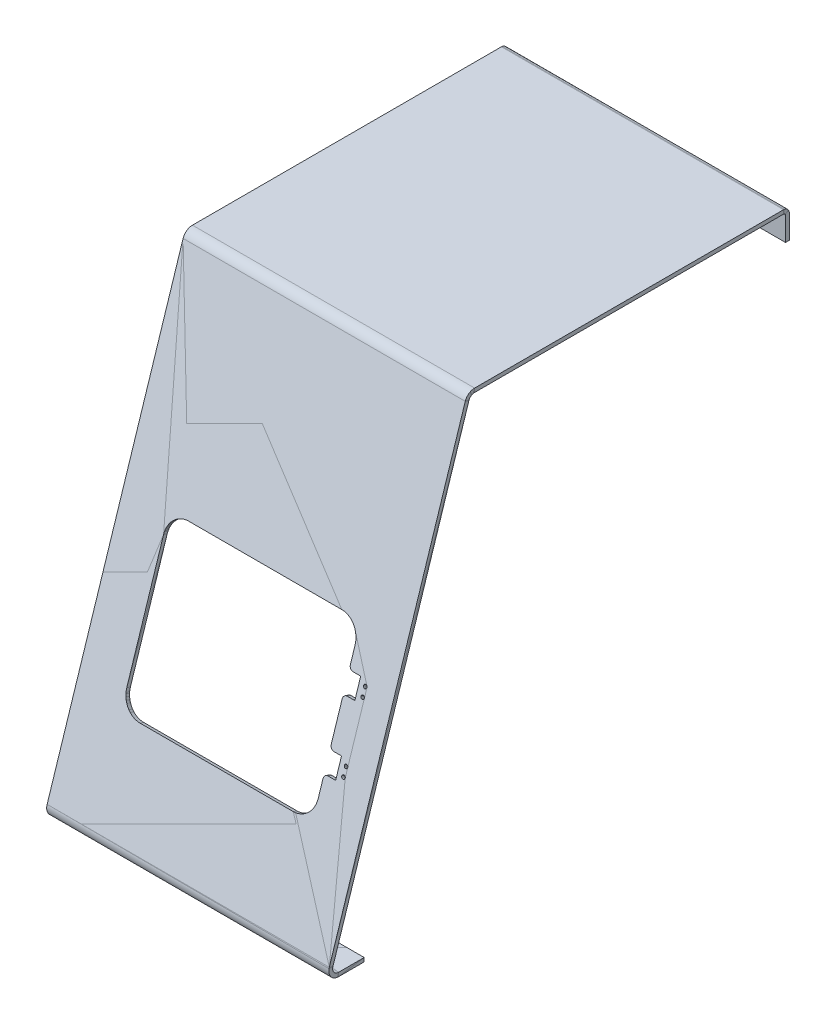
from build123d import *

# Parameters (mm, degrees)
EXTRUDE_THIN1_DEPTH    = 110.5
CUT_EXTRUDE1_REACH     = 444.866
SKETCH2_R              = 1.35
CONVERT_SOLID1_START   = -110.5
CONVERT_SOLID1_DEPTH   = 221
CONVERT_SOLID1_2_DEPTH = 35.5
CONVERT_SOLID1_START_2 = 78
CONVERT_SOLID1_3_DEPTH = 32.5
CONVERT_SOLID1_START_3 = 90.2000001
CONVERT_SOLID1_4_DEPTH = 20.2999999
CONVERT_SOLID1_START_4 = 84
CONVERT_SOLID1_5_DEPTH = 3.4999999
CONVERT_SOLID1_START_5 = 219.608669628
CONVERT_SOLID1_6_DEPTH = 3.000000001


with BuildPart() as part:
    # Sketch1 → Extrude-Thin1 (new, symmetric)
    with BuildSketch(Plane(origin=(0, 0, 0), x_dir=(0, 0, -1), z_dir=(1, 0, 0))):
        with BuildLine():
            Line((122.5, 310), (122.5, 328.5))
            ThreePointArc((122.5, 328.5), (122.060660172, 329.560660172), (121, 330))
            Line((121, 330), (-121.0014, 330))
            ThreePointArc((-121.0014, 330), (-123.764798126, 329.10018419), (-125.468557887, 326.745775479))
            Line((-125.468557887, 326.745775479), (-231.967157887, -3.867817213))
            ThreePointArc((-231.967157887, -3.867817213), (-231.293387843, -8.070194473), (-227.5, -10))
            Line((-227.5, -10), (-207.5, -10))
            Line((-207.5, -10), (-207.5, -13))
            Line((-207.5, -13), (-227.5, -13))
            ThreePointArc((-227.5, -13), (-233.718205595, -9.836619923), (-234.822664414, -2.947989795))
            Line((-234.822664414, -2.947989795), (-128.324064414, 327.665602897))
            ThreePointArc((-128.324064414, 327.665602897), (-125.531223577, 331.525001941), (-121.0014, 333))
            Line((-121.0014, 333), (121, 333))
            ThreePointArc((121, 333), (124.181980515, 331.681980515), (125.5, 328.5))
            Line((125.5, 328.5), (125.5, 310))
            Line((125.5, 310), (122.5, 310))
        make_face()
    extrude(amount=EXTRUDE_THIN1_DEPTH, both=True)

    # Sketch2 → Cut-Extrude1 (cut, up to next)
    with BuildSketch(Plane(origin=(0, 68.253852605, 211.886836303), x_dir=(1, 0, 0), z_dir=(0, 0.30660913934042044, 0.9518355087266532)), mode=Mode.PRIVATE) as cut_extrude1_sk1:
        with Locations(Location((88.85, 87.672559187, 0), (0, 0, 270))):
            Circle(SKETCH2_R)
    cut_extrude1_tool1 = extrude(cut_extrude1_sk1.sketch, amount=-CUT_EXTRUDE1_REACH, mode=Mode.PRIVATE) & part.part
    # Sketch2 → Cut-Extrude1 (cut, up to next)
    with BuildSketch(Plane(origin=(0, 68.253852605, 211.886836303), x_dir=(1, 0, 0), z_dir=(0, 0.30660913934042044, 0.9518355087266532)), mode=Mode.PRIVATE) as cut_extrude1_sk2:
        with Locations(Location((88.85, 81.072559187, 0), (0, 0, 270))):
            Circle(SKETCH2_R)
    cut_extrude1_tool2 = extrude(cut_extrude1_sk2.sketch, amount=-CUT_EXTRUDE1_REACH, mode=Mode.PRIVATE) & part.part
    # Sketch2 → Cut-Extrude1 (cut, up to next)
    with BuildSketch(Plane(origin=(0, 68.253852605, 211.886836303), x_dir=(1, 0, 0), z_dir=(0, 0.30660913934042044, 0.9518355087266532)), mode=Mode.PRIVATE) as cut_extrude1_sk3:
        with Locations(Location((88.85, 38.672559187, 0), (0, 0, 90))):
            Circle(SKETCH2_R)
    cut_extrude1_tool3 = extrude(cut_extrude1_sk3.sketch, amount=-CUT_EXTRUDE1_REACH, mode=Mode.PRIVATE) & part.part
    # Sketch2 → Cut-Extrude1 (cut, up to next)
    with BuildSketch(Plane(origin=(0, 68.253852605, 211.886836303), x_dir=(1, 0, 0), z_dir=(0, 0.30660913934042044, 0.9518355087266532)), mode=Mode.PRIVATE) as cut_extrude1_sk4:
        with Locations(Location((88.85, 32.072559187, 0), (0, 0, 90))):
            Circle(SKETCH2_R)
    cut_extrude1_tool4 = extrude(cut_extrude1_sk4.sketch, amount=-CUT_EXTRUDE1_REACH, mode=Mode.PRIVATE) & part.part
    # Sketch2 → Cut-Extrude1 (cut, up to next)
    with BuildSketch(Plane(origin=(0, 68.253852605, 211.886836303), x_dir=(1, 0, 0), z_dir=(0, 0.30660913934042044, 0.9518355087266532)), mode=Mode.PRIVATE) as cut_extrude1_sk5:
        with BuildLine():
            Line((-60, 121.872559187), (60, 121.872559187))
            ThreePointArc((60, 121.872559187), (70.606601718, 117.479160904), (75, 106.872559187))
            Line((75, 106.872559187), (75, 94.872559187))
            ThreePointArc((75, 94.872559187), (75.878679656, 92.751238843), (78, 91.872559187))
            Line((78, 91.872559187), (84, 91.872559187))
            Line((84, 91.872559187), (84, 76.872559187))
            Line((84, 76.872559187), (78, 76.872559187))
            ThreePointArc((78, 76.872559187), (75.878679656, 75.99387953), (75, 73.872559187))
            Line((75, 73.872559187), (75, 45.872559187))
            ThreePointArc((75, 45.872559187), (75.878679656, 43.751238843), (78, 42.872559187))
            Line((78, 42.872559187), (84, 42.872559187))
            Line((84, 42.872559187), (84, 27.872559187))
            Line((84, 27.872559187), (78, 27.872559187))
            ThreePointArc((78, 27.872559187), (75.878679656, 26.99387953), (75, 24.872559187))
            Line((75, 24.872559187), (75, 12.872559187))
            ThreePointArc((75, 12.872559187), (70.606601718, 2.265957469), (60, -2.127440813))
            Line((60, -2.127440813), (-60, -2.127440813))
            ThreePointArc((-60, -2.127440813), (-70.606601718, 2.265957469), (-75, 12.872559187))
            Line((-75, 12.872559187), (-75, 106.872559187))
            ThreePointArc((-75, 106.872559187), (-70.606601718, 117.479160904), (-60, 121.872559187))
        make_face()
    cut_extrude1_tool5 = extrude(cut_extrude1_sk5.sketch, amount=-CUT_EXTRUDE1_REACH, mode=Mode.PRIVATE) & part.part
    add(cut_extrude1_tool1.solids().sort_by_distance((88.85, 151.703708, 185.005628))[0], mode=Mode.SUBTRACT)
    add(cut_extrude1_tool2.solids().sort_by_distance((88.85, 145.421593, 187.029249))[0], mode=Mode.SUBTRACT)
    add(cut_extrude1_tool3.solids().sort_by_distance((88.85, 105.063768, 200.029476))[0], mode=Mode.SUBTRACT)
    add(cut_extrude1_tool4.solids().sort_by_distance((88.85, 98.781653, 202.053097))[0], mode=Mode.SUBTRACT)
    add(cut_extrude1_tool5.solids().sort_by_distance((1.180096, 125.24268, 193.529362))[0], mode=Mode.SUBTRACT)


with BuildPart() as body_2:
    # Convert-Solid1: read off the stored shape, not the designer's step
    # Convert-Solid1 outline → Convert-Solid1 (new body)
    with BuildSketch(Plane.YZ.offset(CONVERT_SOLID1_START)):
        with BuildLine():
            Line((-13, 227.5), (-13, 207.5))
            Line((-13, 207.5), (-10, 207.5))
            Line((-10, 207.5), (-10, 227.5))
            ThreePointArc((-10, 227.5), (-8.070194473, 231.293387843), (-3.867817213, 231.967157887))
            Line((-3.867817213, 231.967157887), (65.309051478, 209.683622573))
            Line((65.309051478, 209.683622573), (66.228878896, 212.5391291))
            Line((66.228878896, 212.5391291), (-2.947989795, 234.822664414))
            ThreePointArc((-2.947989795, 234.822664414), (-9.836619923, 233.718205595), (-13, 227.5))
        make_face()
        with BuildLine():
            Line((327.665602897, 128.324064414), (184.256481978, 174.519595822))
            Line((184.256481978, 174.519595822), (183.33665456, 171.664089295))
            Line((183.33665456, 171.664089295), (326.745775479, 125.468557887))
            ThreePointArc((326.745775479, 125.468557887), (329.10018419, 123.764798127), (330, 121.0014))
            Line((330, 121.0014), (330, -121))
            ThreePointArc((330, -121), (329.560660172, -122.060660172), (328.5, -122.5))
            Line((328.5, -122.5), (310, -122.5))
            Line((310, -122.5), (310, -125.5))
            Line((310, -125.5), (328.5, -125.5))
            ThreePointArc((328.5, -125.5), (331.681980515, -124.181980515), (333, -121))
            Line((333, -121), (333, 121.0014))
            ThreePointArc((333, 121.0014), (331.525001941, 125.531223577), (327.665602897, 128.324064414))
        make_face()
    extrude(amount=CONVERT_SOLID1_DEPTH)

    # Convert-Solid1 2 outline → Convert-Solid1 2 (add)
    with BuildSketch(Plane.YZ.offset(CONVERT_SOLID1_START)):
        Polygon((66.228878896, 212.5391291), (65.309051478, 209.683622574), (183.33665456, 171.664089295), (184.256481978, 174.519595822), align=None)
    extrude(amount=CONVERT_SOLID1_2_DEPTH)

    # Convert-Solid1 3 outline → Convert-Solid1 3 (add)
    with BuildSketch(Plane.YZ.offset(CONVERT_SOLID1_START_2)):
        Polygon((94.783944157, 203.34085492), (66.228878896, 212.5391291), (65.309051478, 209.683622574), (93.864116739, 200.485348393), align=None)
        Polygon((141.423884085, 188.317007092), (109.061476788, 198.74171783), (108.14164937, 195.886211303), (140.504056667, 185.461500565), align=None)
        Polygon((184.256481978, 174.519595822), (155.701416716, 183.717870002), (154.781589298, 180.862363476), (183.33665456, 171.664089295), align=None)
    extrude(amount=CONVERT_SOLID1_3_DEPTH)

    # Convert-Solid1 4 outline → Convert-Solid1 4 (add)
    with BuildSketch(Plane.YZ.offset(CONVERT_SOLID1_START_3)):
        Polygon((109.061476788, 198.74171783), (94.783944157, 203.34085492), (93.864116739, 200.485348393), (108.14164937, 195.886211303), align=None)
        Polygon((155.701416716, 183.717870002), (141.423884085, 188.317007092), (140.504056667, 185.461500566), (154.781589298, 180.862363475), align=None)
    extrude(amount=CONVERT_SOLID1_4_DEPTH)

    # Convert-Solid1 5 outline → Convert-Solid1 5 (add)
    with BuildSketch(Plane.YZ.offset(CONVERT_SOLID1_START_4)):
        Polygon((109.061476788, 198.74171783), (94.783944157, 203.34085492), (93.864116739, 200.485348393), (108.14164937, 195.886211303), align=None)
        Polygon((155.701416716, 183.717870002), (141.423884085, 188.317007092), (140.504056667, 185.461500566), (154.781589298, 180.862363475), align=None)
    extrude(amount=CONVERT_SOLID1_5_DEPTH)

    # Convert-Solid1 6 outline → Convert-Solid1 6 (add)
    with BuildSketch(Plane(origin=(0, 0, 0), x_dir=(1, 0, 0), z_dir=(0, 0.3066091393404201, 0.9518355087266533)).offset(CONVERT_SOLID1_START_5)):
        with BuildLine():
            Line((90.2000001, 27.872559186), (90.2, 32.072559187))
            ThreePointArc((90.2, 32.072559187), (88.85, 30.722559187), (87.5, 32.072559187))
            Line((87.5, 32.072559187), (87.4999999, 27.872559186))
            Line((87.4999999, 27.872559186), (90.2000001, 27.872559186))
        make_face()
        with BuildLine():
            ThreePointArc((87.5, 32.072559187), (88.85, 33.422559187), (90.2, 32.072559187))
            Line((90.2, 32.072559187), (90.2, 38.672559187))
            ThreePointArc((90.2, 38.672559187), (88.85, 37.322559187), (87.5, 38.672559187))
            Line((87.5, 38.672559187), (87.5, 32.072559187))
        make_face()
        with BuildLine():
            ThreePointArc((87.5, 38.672559187), (88.85, 40.022559187), (90.2, 38.672559187))
            Line((90.2, 38.672559187), (90.2000001, 42.872559186))
            Line((90.2000001, 42.872559186), (87.4999999, 42.872559186))
            Line((87.4999999, 42.872559186), (87.5, 38.672559187))
        make_face()
        with BuildLine():
            Line((90.2000001, 76.872559186), (90.2, 81.072559187))
            ThreePointArc((90.2, 81.072559187), (88.85, 79.722559187), (87.5, 81.072559187))
            Line((87.5, 81.072559187), (87.4999999, 76.872559186))
            Line((87.4999999, 76.872559186), (90.2000001, 76.872559186))
        make_face()
        with BuildLine():
            ThreePointArc((87.5, 81.072559187), (88.85, 82.422559187), (90.2, 81.072559187))
            Line((90.2, 81.072559187), (90.2, 87.672559187))
            ThreePointArc((90.2, 87.672559187), (88.85, 86.322559187), (87.5, 87.672559187))
            Line((87.5, 87.672559187), (87.5, 81.072559187))
        make_face()
        with BuildLine():
            ThreePointArc((87.5, 87.672559187), (88.85, 89.022559187), (90.2, 87.672559187))
            Line((90.2, 87.672559187), (90.2000001, 91.872559187))
            Line((90.2000001, 91.872559187), (87.4999999, 91.872559187))
            Line((87.4999999, 91.872559187), (87.5, 87.672559187))
        make_face()
        with BuildLine():
            Line((78, -2.127440813), (78, 27.872559187))
            ThreePointArc((78, 27.872559187), (75.878679656, 26.99387953), (75, 24.872559187))
            Line((75, 24.872559187), (75, 12.872559187))
            ThreePointArc((75, 12.872559187), (70.606601718, 2.265957469), (60, -2.127440813))
            Line((60, -2.127440813), (78, -2.127440813))
        make_face()
        with BuildLine():
            Line((78, 121.872559187), (60, 121.872559187))
            ThreePointArc((60, 121.872559187), (70.606601717, 117.479160904), (75, 106.872559187))
            Line((75, 106.872559187), (75, 94.872559187))
            ThreePointArc((75, 94.872559187), (75.878679656, 92.751238843), (78, 91.872559187))
            Line((78, 91.872559187), (78, 121.872559187))
        make_face()
        with BuildLine():
            Line((-75, 121.872559187), (-75, 106.872559187))
            ThreePointArc((-75, 106.872559187), (-70.606601717, 117.479160904), (-60, 121.872559187))
            Line((-60, 121.872559187), (-75, 121.872559187))
        make_face()
        with BuildLine():
            Line((-75, -2.127440813), (-60, -2.127440813))
            ThreePointArc((-60, -2.127440813), (-70.606601718, 2.265957469), (-75, 12.872559187))
            Line((-75, 12.872559187), (-75, -2.127440813))
        make_face()
        with BuildLine():
            Line((75, 73.872559187), (75, 45.872559187))
            ThreePointArc((75, 45.872559187), (75.878679656, 43.751238843), (78, 42.872559187))
            Line((78, 42.872559187), (78, 76.872559187))
            ThreePointArc((78, 76.872559187), (75.878679656, 75.99387953), (75, 73.872559187))
        make_face()
    extrude(amount=CONVERT_SOLID1_6_DEPTH)


solid = Compound([part.part, body_2.part])
